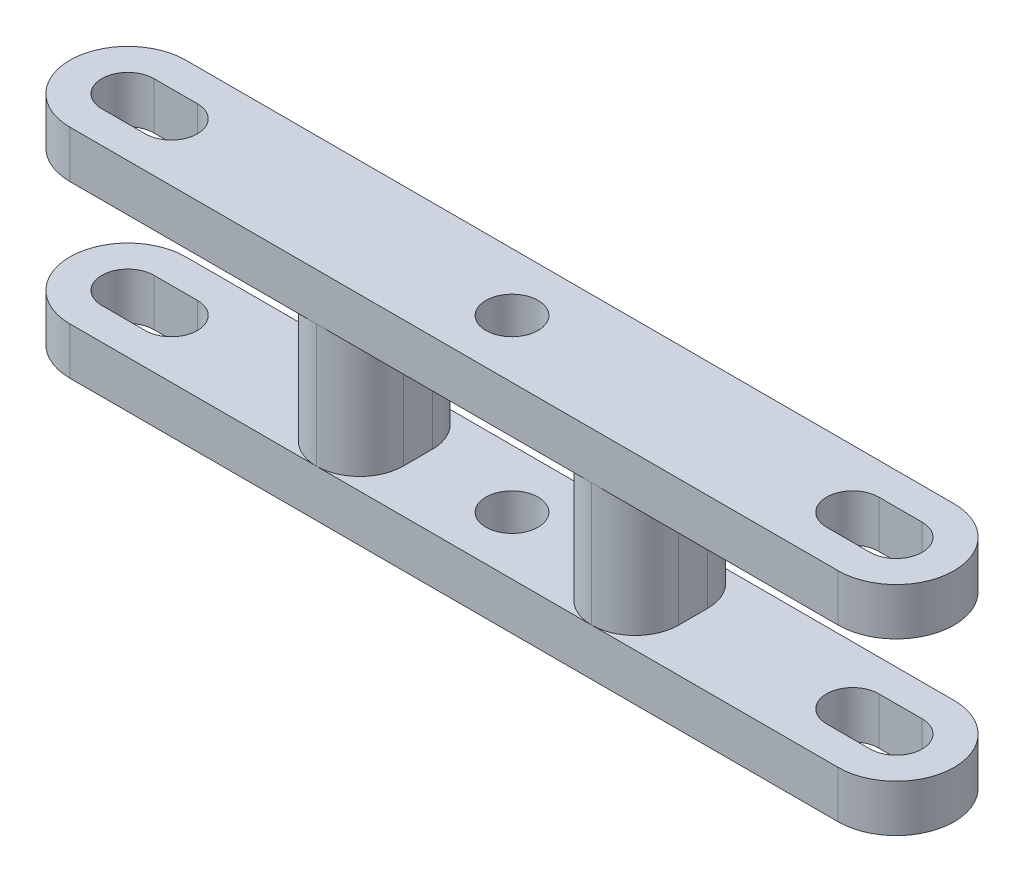
from build123d import *

# Parameters (mm, degrees)
SKETCH1_R           = 2.286
BOSS_EXTRUDE1_DEPTH = 9.525
SKETCH3_W           = 22.86
SKETCH3_H           = 10.795
SKETCH3_W_2         = 16.51
CUT_EXTRUDE1_DEPTH  = 42.162500531
FILLET1_R           = 3.81


with BuildPart() as part:
    # Sketch1 → Boss-Extrude1 (new, symmetric)
    with BuildSketch(Plane(origin=(0, 0, 0), x_dir=(1, 0, 0), z_dir=(0, 1, 0))):
        with BuildLine():
            Line((33.655, -5.08), (-33.655, -5.08))
            ThreePointArc((-33.655, -5.08), (-38.735, 0), (-33.655, 5.08))
            Line((-33.655, 5.08), (33.655, 5.08))
            ThreePointArc((33.655, 5.08), (38.735, 0), (33.655, -5.08))
        make_face()
        with Locations(Location((0, 0, 0), (0, 0, 90))):
            Circle(SKETCH1_R, mode=Mode.SUBTRACT)
        with BuildLine():
            Line((33.655, -2.286), (29.845, -2.286))
            ThreePointArc((29.845, -2.286), (27.559, 0), (29.845, 2.286))
            Line((29.845, 2.286), (33.655, 2.286))
            ThreePointArc((33.655, 2.286), (35.941, 0), (33.655, -2.286))
        make_face(mode=Mode.SUBTRACT)
        with BuildLine():
            Line((-33.655, 2.286), (-29.845, 2.286))
            ThreePointArc((-29.845, 2.286), (-27.559, 0), (-29.845, -2.286))
            Line((-29.845, -2.286), (-33.655, -2.286))
            ThreePointArc((-33.655, -2.286), (-35.941, 0), (-33.655, 2.286))
        make_face(mode=Mode.SUBTRACT)
    extrude(amount=BOSS_EXTRUDE1_DEPTH, both=True)

    # Sketch3 → Cut-Extrude1 (cut, through all)
    with BuildSketch(Plane.XY.offset(5.08)):
        with Locations((-27.305, 0)):
            Rectangle(SKETCH3_W, SKETCH3_H)
        Rectangle(SKETCH3_W_2, SKETCH3_H)
        with Locations((27.305, 0)):
            Rectangle(SKETCH3_W, SKETCH3_H)
    extrude(amount=-CUT_EXTRUDE1_DEPTH, mode=Mode.SUBTRACT)

    # Fillet1
    fillet1_edges = [part.edges().sort_by_distance(p)[0] for p in [
        (15.875, 0, -5.08),
        (15.875, 0, 5.08),
        (-15.875, 0, 5.08),
        (-15.875, 0, -5.08),
        (-8.255, 0, -5.08),
        (8.255, 0, -5.08),
        (-8.255, 0, 5.08),
        (8.255, 0, 5.08),
    ]]
    fillet(fillet1_edges, radius=FILLET1_R - 0.0001)  # a hair under: the kernel refuses the full size


solid = part.part
